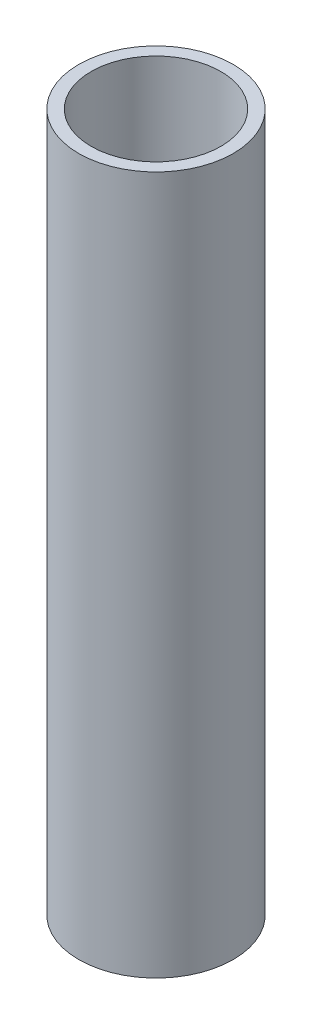
from build123d import *

# Parameters (mm, degrees)
SKETCH1_R           = 12.500000019
SKETCH1_R_2         = 10.499999955
BOSS_EXTRUDE1_DEPTH = 113


with BuildPart() as part:
    # Sketch1 → Boss-Extrude1 (new body)
    with BuildSketch(Plane(origin=(0, 0, 0), x_dir=(1, 0, 0), z_dir=(0, 1, 0))):
        Circle(SKETCH1_R)
        Circle(SKETCH1_R_2, mode=Mode.SUBTRACT)
    extrude(amount=BOSS_EXTRUDE1_DEPTH)


solid = part.part
